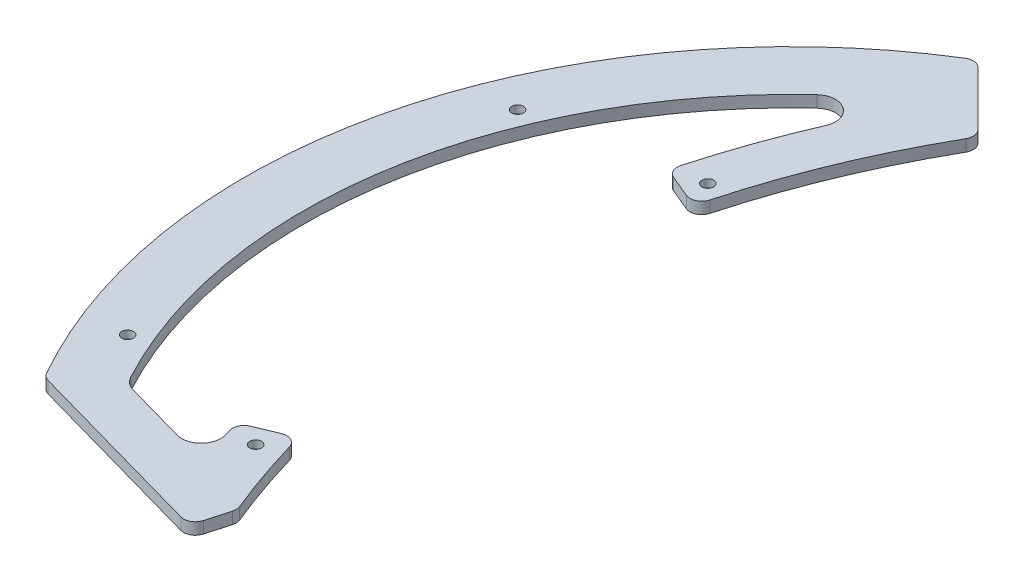
from build123d import *

# Parameters (mm, degrees)
SKETCH1_R               = 140
BOSS_EXTRUDE1_DEPTH     = 3
CUT_EXTRUDE1_REACH      = 200.013
CUT_EXTRUDE3_REACH      = 200.013
SKETCH19_R              = 1.5
CUT_EXTRUDE10_REACH     = 200.013
SKETCH25_R              = 1.5
CUT_EXTRUDE4_REACH      = 200.013
FILLET2_R               = 10
CUT_EXTRUDE8_DEPTH      = 185.458667457
CUT_EXTRUDE8_DEPTH_BACK = 185.458667457
CUT_EXTRUDE9_REACH      = 186.459
FILLET4_R               = 5
FILLET5_R               = 3
SKETCH26_R              = 3
CUT_EXTRUDE11_DEPTH     = 1


with BuildPart() as part:
    # Sketch1 → Boss-Extrude1 (new body)
    with BuildSketch(Plane(origin=(0, 0, 0), x_dir=(1, 0, 0), z_dir=(0, 1, 0))):
        Circle(SKETCH1_R)
    extrude(amount=BOSS_EXTRUDE1_DEPTH)

    # Sketch17 → Cut-Extrude1 (cut, up to next)
    with BuildSketch(Plane.XZ, mode=Mode.PRIVATE) as cut_extrude1_sk1:
        Polygon((-50, 90), (-121.24355653, 70), (-121.24355653, 140), (121.24355653, 140), (121.24355653, 70), (50, 90), align=None)
    cut_extrude1_tool1 = extrude(cut_extrude1_sk1.sketch, amount=-CUT_EXTRUDE1_REACH, mode=Mode.PRIVATE) & part.part
    add(cut_extrude1_tool1.solids().sort_by_distance((0, 0, 111.669853))[0], mode=Mode.SUBTRACT)

    # Sketch19 → Cut-Extrude3 (cut, up to next)
    with BuildSketch(Plane(origin=(0, 3, 0), x_dir=(1, 0, 0), z_dir=(0, 1, 0)), mode=Mode.PRIVATE) as cut_extrude3_sk1:
        with Locations((-79.195959493, -57.982756057)):
            Circle(SKETCH19_R)
    cut_extrude3_tool1 = extrude(cut_extrude3_sk1.sketch, amount=-CUT_EXTRUDE3_REACH, mode=Mode.PRIVATE) & part.part
    # Sketch19 → Cut-Extrude3 (cut, up to next)
    with BuildSketch(Plane(origin=(0, 3, 0), x_dir=(1, 0, 0), z_dir=(0, 1, 0)), mode=Mode.PRIVATE) as cut_extrude3_sk2:
        with Locations((-79.195959493, 57.982756057)):
            Circle(SKETCH19_R)
    cut_extrude3_tool2 = extrude(cut_extrude3_sk2.sketch, amount=-CUT_EXTRUDE3_REACH, mode=Mode.PRIVATE) & part.part
    # Sketch19 → Cut-Extrude3 (cut, up to next)
    with BuildSketch(Plane(origin=(0, 3, 0), x_dir=(1, 0, 0), z_dir=(0, 1, 0)), mode=Mode.PRIVATE) as cut_extrude3_sk3:
        with Locations((79.195959493, 57.982756057)):
            Circle(SKETCH19_R)
    cut_extrude3_tool3 = extrude(cut_extrude3_sk3.sketch, amount=-CUT_EXTRUDE3_REACH, mode=Mode.PRIVATE) & part.part
    # Sketch19 → Cut-Extrude3 (cut, up to next)
    with BuildSketch(Plane(origin=(0, 3, 0), x_dir=(1, 0, 0), z_dir=(0, 1, 0)), mode=Mode.PRIVATE) as cut_extrude3_sk4:
        with Locations((79.195959493, -57.982756057)):
            Circle(SKETCH19_R)
    cut_extrude3_tool4 = extrude(cut_extrude3_sk4.sketch, amount=-CUT_EXTRUDE3_REACH, mode=Mode.PRIVATE) & part.part
    # Sketch19 → Cut-Extrude3 (cut, up to next)
    with BuildSketch(Plane(origin=(0, 3, 0), x_dir=(1, 0, 0), z_dir=(0, 1, 0)), mode=Mode.PRIVATE) as cut_extrude3_sk5:
        with Locations((-57.982756057, 79.195959493)):
            Circle(SKETCH19_R)
    cut_extrude3_tool5 = extrude(cut_extrude3_sk5.sketch, amount=-CUT_EXTRUDE3_REACH, mode=Mode.PRIVATE) & part.part
    # Sketch19 → Cut-Extrude3 (cut, up to next)
    with BuildSketch(Plane(origin=(0, 3, 0), x_dir=(1, 0, 0), z_dir=(0, 1, 0)), mode=Mode.PRIVATE) as cut_extrude3_sk6:
        with Locations((57.982756057, 79.195959493)):
            Circle(SKETCH19_R)
    cut_extrude3_tool6 = extrude(cut_extrude3_sk6.sketch, amount=-CUT_EXTRUDE3_REACH, mode=Mode.PRIVATE) & part.part
    # Sketch19 → Cut-Extrude3 (cut, up to next)
    with BuildSketch(Plane(origin=(0, 3, 0), x_dir=(1, 0, 0), z_dir=(0, 1, 0)), mode=Mode.PRIVATE) as cut_extrude3_sk7:
        with Locations((57.982756057, -79.195959493)):
            Circle(SKETCH19_R)
    cut_extrude3_tool7 = extrude(cut_extrude3_sk7.sketch, amount=-CUT_EXTRUDE3_REACH, mode=Mode.PRIVATE) & part.part
    # Sketch19 → Cut-Extrude3 (cut, up to next)
    with BuildSketch(Plane(origin=(0, 3, 0), x_dir=(1, 0, 0), z_dir=(0, 1, 0)), mode=Mode.PRIVATE) as cut_extrude3_sk8:
        with Locations((-57.982756057, -79.195959493)):
            Circle(SKETCH19_R)
    cut_extrude3_tool8 = extrude(cut_extrude3_sk8.sketch, amount=-CUT_EXTRUDE3_REACH, mode=Mode.PRIVATE) & part.part
    add(cut_extrude3_tool1.solids().sort_by_distance((-79.195959, 3, 57.982756))[0], mode=Mode.SUBTRACT)
    add(cut_extrude3_tool2.solids().sort_by_distance((-79.195959, 3, -57.982756))[0], mode=Mode.SUBTRACT)
    add(cut_extrude3_tool3.solids().sort_by_distance((79.195959, 3, -57.982756))[0], mode=Mode.SUBTRACT)
    add(cut_extrude3_tool4.solids().sort_by_distance((79.195959, 3, 57.982756))[0], mode=Mode.SUBTRACT)
    add(cut_extrude3_tool5.solids().sort_by_distance((-57.982756, 3, -79.195959))[0], mode=Mode.SUBTRACT)
    add(cut_extrude3_tool6.solids().sort_by_distance((57.982756, 3, -79.195959))[0], mode=Mode.SUBTRACT)
    add(cut_extrude3_tool7.solids().sort_by_distance((57.982756, 3, 79.195959))[0], mode=Mode.SUBTRACT)
    add(cut_extrude3_tool8.solids().sort_by_distance((-57.982756, 3, 79.195959))[0], mode=Mode.SUBTRACT)

    # Sketch25 → Cut-Extrude10 (cut, up to next)
    with BuildSketch(Plane(origin=(0, 3, 0), x_dir=(1, 0, 0), z_dir=(0, 1, 0)), mode=Mode.PRIVATE) as cut_extrude10_sk1:
        with Locations((-120, 50)):
            Circle(SKETCH25_R)
    cut_extrude10_tool1 = extrude(cut_extrude10_sk1.sketch, amount=-CUT_EXTRUDE10_REACH, mode=Mode.PRIVATE) & part.part
    # Sketch25 → Cut-Extrude10 (cut, up to next)
    with BuildSketch(Plane(origin=(0, 3, 0), x_dir=(1, 0, 0), z_dir=(0, 1, 0)), mode=Mode.PRIVATE) as cut_extrude10_sk2:
        with Locations((-120, -50)):
            Circle(SKETCH25_R)
    cut_extrude10_tool2 = extrude(cut_extrude10_sk2.sketch, amount=-CUT_EXTRUDE10_REACH, mode=Mode.PRIVATE) & part.part
    add(cut_extrude10_tool1.solids().sort_by_distance((-120, 3, -50))[0], mode=Mode.SUBTRACT)
    add(cut_extrude10_tool2.solids().sort_by_distance((-120, 3, 50))[0], mode=Mode.SUBTRACT)

    # Sketch20 → Cut-Extrude4 (cut, up to next)
    with BuildSketch(Plane(origin=(0, 3, 0), x_dir=(1, 0, 0), z_dir=(0, 1, 0)), mode=Mode.PRIVATE) as cut_extrude4_sk1:
        Polygon((-501.142143979, 549.208792138), (-72, 120.066648158), (-50, 98.066648158), (50, 98.066648158), (72, 120.066648158), (501.142143979, 549.208792138), (501.142143979, 1763.00607254), (-501.142143979, 1763.00607254), align=None)
    cut_extrude4_tool1 = extrude(cut_extrude4_sk1.sketch, amount=-CUT_EXTRUDE4_REACH, mode=Mode.PRIVATE) & part.part
    add(cut_extrude4_tool1.solids().sort_by_distance((0, 3, -1025.283687))[0], mode=Mode.SUBTRACT)

    # Fillet2
    fillet2_edges = [part.edges().sort_by_distance(p)[0] for p in [
        (50, 1.5, -98.066648158),
        (-50, 1.5, -98.066648158),
    ]]
    fillet(fillet2_edges, radius=FILLET2_R)

    # Sketch23 → Cut-Extrude8 (cut, two sides: drawn at the far end of the back side and taken through both)
    with BuildSketch(Plane(origin=(0, 3, 0), x_dir=(1, 0, 0), z_dir=(0, 1, 0)).offset(-CUT_EXTRUDE8_DEPTH_BACK)):
        with BuildLine():
            Line((257.25555619, 635.882543767), (-54.933351842, 103))
            ThreePointArc((-54.933351842, 103), (-81.898962794, 15.574433529), (-67.110613718, -74.712213204))
            Line((-67.110613718, -74.712213204), (-73.189737717, -96.367133919))
            Line((-73.189737717, -96.367133919), (-240.113193325, -690.978166206))
            Line((-240.113193325, -690.978166206), (916.492938423, -1124.527627053))
            Line((916.492938423, -1124.527627053), (1413.861687938, 202.33308292))
            Line((1413.861687938, 202.33308292), (257.25555619, 635.882543767))
        make_face()
    extrude(amount=CUT_EXTRUDE8_DEPTH + CUT_EXTRUDE8_DEPTH_BACK, mode=Mode.SUBTRACT)

    # Sketch24 → Cut-Extrude9 (cut, up to next)
    with BuildSketch(Plane(origin=(0, 3, 0), x_dir=(1, 0, 0), z_dir=(0, 1, 0)), mode=Mode.PRIVATE) as cut_extrude9_sk1:
        with BuildLine():
            Line((-87.357146899, 55.966584143), (-76.169199175, 51.304939258))
            Line((-76.169199175, 51.304939258), (-75.263305358, -50.927483501))
            Line((-75.263305358, -50.927483501), (-86.425648637, -55.578459868))
            ThreePointArc((-86.425648637, -55.578459868), (-84.491324796, -62.048707618), (-82.351900579, -68.454063088))
            Line((-82.351900579, -68.454063088), (-109.142815319, -60.933126165))
            ThreePointArc((-109.142815319, -60.933126165), (-121.247849947, 30.39669198), (-67.489752352, 105.2147011))
            ThreePointArc((-67.489752352, 105.2147011), (-78.971583679, 81.215182034), (-87.357146899, 55.966584143))
        make_face()
    cut_extrude9_tool1 = extrude(cut_extrude9_sk1.sketch, amount=-CUT_EXTRUDE9_REACH, mode=Mode.PRIVATE) & part.part
    add(cut_extrude9_tool1.solids().sort_by_distance((-97.439624, 3, -6.929648))[0], mode=Mode.SUBTRACT)

    # Fillet4
    fillet4_edges = [part.edges().sort_by_distance(p)[0] for p in [
        (-82.351900579, 1.5, 68.454063088),
        (-109.142815319, 1.5, 60.933126165),
        (-67.489752352, 1.5, -105.2147011),
    ]]
    fillet(fillet4_edges, radius=FILLET4_R)

    # Fillet5
    fillet5_edges = [part.edges().sort_by_distance(p)[0] for p in [
        (-72, 1.5, -120.066648158),
        (-67.110613718, 1.5, 74.712213204),
        (-69.838855295, 1.5, 84.430694855),
        (-121.24355653, 1.5, 70),
        (-54.933351842, 1.5, -103),
        (-86.425648637, 1.5, 55.578459868),
        (-75.263305358, 1.5, 50.927483501),
        (-87.357146899, 1.5, -55.966584143),
        (-76.169199175, 1.5, -51.304939258),
    ]]
    fillet(fillet5_edges, radius=FILLET5_R)

    # Sketch26 → Cut-Extrude11 (cut)
    with BuildSketch(Plane.XZ):
        with Locations((-79.195959493, 57.982756057)):
            Circle(SKETCH26_R)
        with Locations((-120, 50)):
            Circle(SKETCH26_R)
        with Locations((-120, -50)):
            Circle(SKETCH26_R)
        with Locations((-79.195959493, -57.982756057)):
            Circle(SKETCH26_R)
    extrude(amount=-CUT_EXTRUDE11_DEPTH, mode=Mode.SUBTRACT)


solid = part.part
